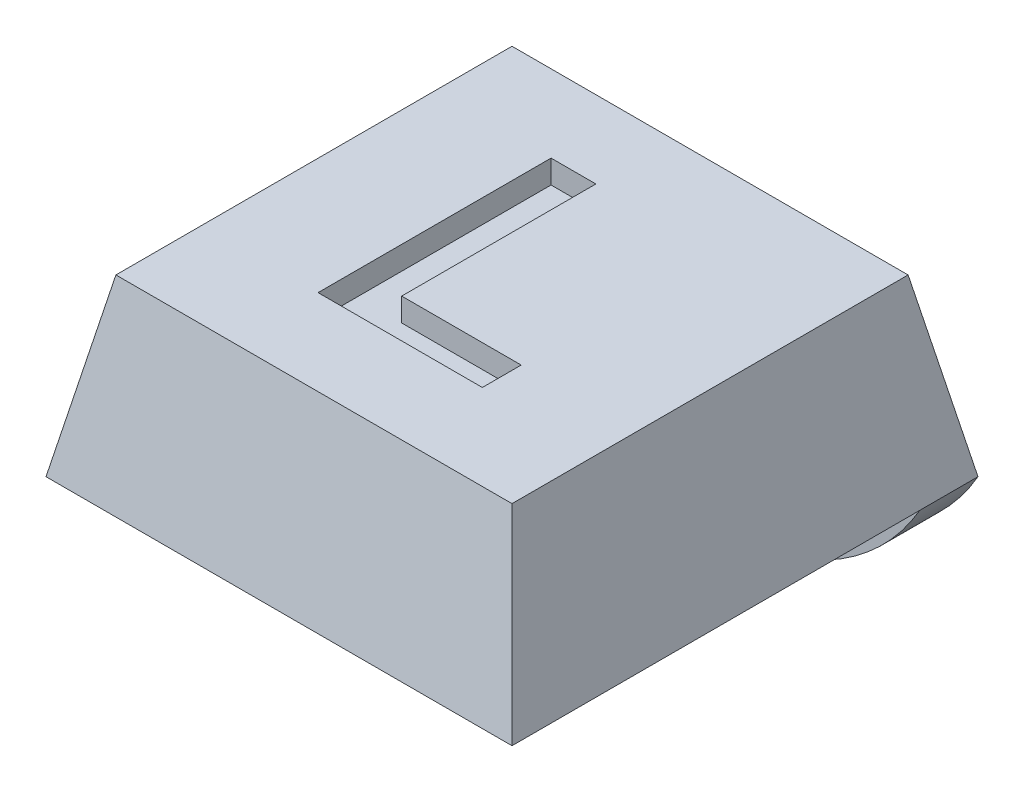
from build123d import *

# Parameters (mm, degrees)
SKETCH1_W               = 8
SKETCH1_H               = 8
BOSS_EXTRUDE1_DEPTH     = 3
CUT_EXTRUDE1_DEPTH      = 12.704699911
CUT_EXTRUDE1_DEPTH_BACK = 12.704699911
CUT_EXTRUDE2_DEPTH      = 11
SKETCH4_R               = 1.8
CUT_EXTRUDE3_DEPTH      = 0.8
SKETCH5_W               = 8
SKETCH5_H               = 1
BOSS_EXTRUDE2_DEPTH     = 2
FILLET1_R               = 4
CUT_EXTRUDE4_DEPTH      = 0.4


with BuildPart() as part:
    # Sketch1 → Boss-Extrude1 (new body)
    with BuildSketch(Plane(origin=(0, 0, 0), x_dir=(1, 0, 0), z_dir=(0, 1, 0))):
        with Locations((4, 4)):
            Rectangle(SKETCH1_W, SKETCH1_H)
    extrude(amount=BOSS_EXTRUDE1_DEPTH)

    # Sketch2 → Cut-Extrude1 (cut, two sides: drawn at the far end of the back side and taken through both)
    with BuildSketch(Plane.XY.offset(-CUT_EXTRUDE1_DEPTH_BACK)):
        Polygon((0, 0), (0.6, 3), (0, 3), align=None)
        Polygon((8, 0), (7.4, 3), (8, 3), align=None)
    extrude(amount=CUT_EXTRUDE1_DEPTH + CUT_EXTRUDE1_DEPTH_BACK, mode=Mode.SUBTRACT)

    # Sketch3 → Cut-Extrude2 (cut)
    with BuildSketch(Plane(origin=(0, 0, 0), x_dir=(0, 0, -1), z_dir=(1, 0, 0))):
        Polygon((0, 0), (0.6, 3), (0, 3), align=None)
        Polygon((8, 3), (7.4, 3), (8, 0), align=None)
    extrude(amount=CUT_EXTRUDE2_DEPTH, mode=Mode.SUBTRACT)

    # Sketch4 → Cut-Extrude3 (cut)
    with BuildSketch(Plane.XZ):
        with Locations(Location((4, -3.75, 0), (0, 0, 270))):
            Circle(SKETCH4_R)
    extrude(amount=-CUT_EXTRUDE3_DEPTH, mode=Mode.SUBTRACT)

    # Sketch5 → Boss-Extrude2 (add)
    with BuildSketch(Plane.XZ):
        with Locations((4, -7.5)):
            Rectangle(SKETCH5_W, SKETCH5_H)
    extrude(amount=BOSS_EXTRUDE2_DEPTH)

    # Fillet1
    # the kernel refuses this fillet: 4 mm, written as the material it takes off along each edge
    with BuildSketch(Plane(origin=(8, -2, -16.660254038), x_dir=(0, 1, 0), z_dir=(0, 0, 1)), Plane(origin=(0, -2, 1.660254038), x_dir=(0, 1, 0), z_dir=(0, 0, -1))) as fillet1_piece_1:
        with BuildLine():
            CenterArc((4, 3.464101615), FILLET1_R, 180, 60)
            Line((0, 3.464101615), (-0.08, 3.464101615))
            Line((-0.08, 3.464101615), (-0.08, 0))
            Line((-0.08, 0), (0, -0.08))
            ThreePointArc((0, -0.08), (1, -0.08), (1.96, -0.069282032))
            Line((1.96, -0.069282032), (2, 0))
        make_face()
    extrude(amount=18.320508076, mode=Mode.SUBTRACT)

    # Sketch6 → Cut-Extrude4 (cut)
    with BuildSketch(Plane(origin=(0, 3, 0), x_dir=(1, 0, 0), z_dir=(0, 1, 0))):
        Polygon((2.598201218, 2.07225421), (2.598201218, 6.07225421), (3.367431987, 6.07225421), (3.367431987, 2.738920877), (5.418714038, 2.738920877), (5.418714038, 2.07225421), align=None)
    extrude(amount=-CUT_EXTRUDE4_DEPTH, mode=Mode.SUBTRACT)


solid = part.part
